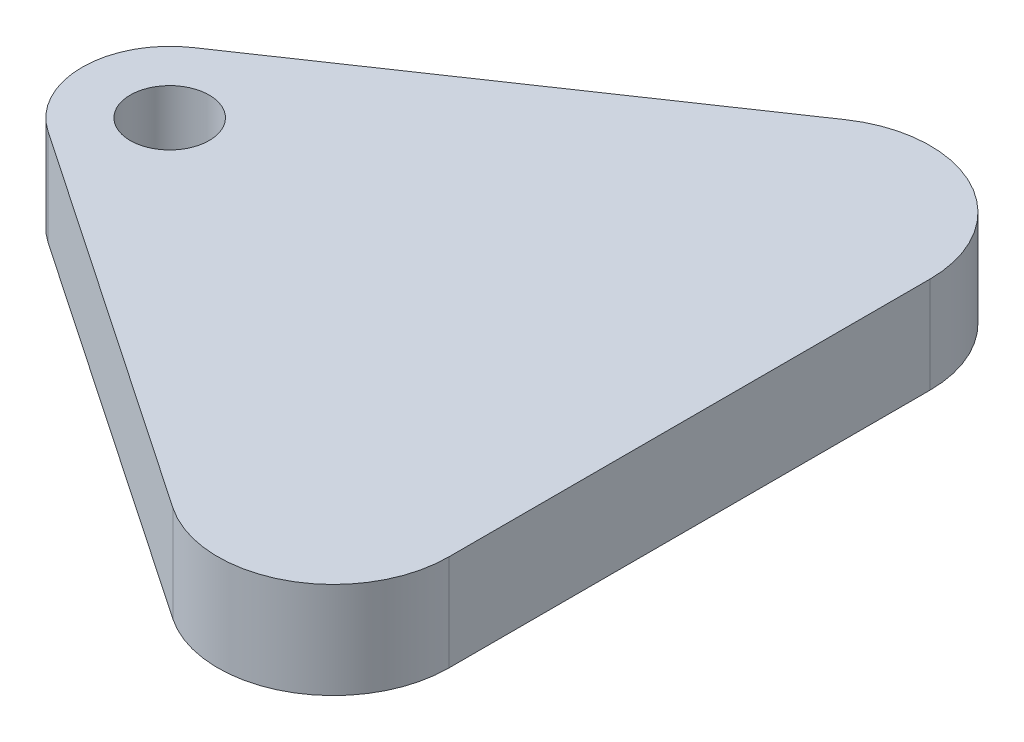
from build123d import *

# Parameters (mm, degrees)
SKETCH_1_R          = 4.1
EXTRUDE_1_DEPTH     = 10
SKETCH_2_W          = 10.2
SKETCH_2_H          = 10.2
CUT_EXTRUDE_1_DEPTH = 5


with BuildPart() as part:
    # ｽｹｯﾁ1 → ﾎﾞｽ - 押し出し1 (new body)
    with BuildSketch(Plane(origin=(0, 0, 0), x_dir=(1, 0, 0), z_dir=(0, 1, 0))):
        with BuildLine():
            Line((-47.110254718, 7.529627927), (-6.738797431, 34.929179684))
            ThreePointArc((-6.738797431, 34.929179684), (5.618470914, 35.603432679), (12, 25))
            Line((12, 25), (12, -25))
            ThreePointArc((12, -25), (5.618470914, -35.603432679), (-6.738797431, -34.929179684))
            Line((-6.738797431, -34.929179684), (-47.110254718, -7.529627927))
            ThreePointArc((-47.110254718, -7.529627927), (-51.1, 0), (-47.110254718, 7.529627927))
        make_face()
        with Locations((-42, 0)):
            Circle(SKETCH_1_R, mode=Mode.SUBTRACT)
    extrude(amount=EXTRUDE_1_DEPTH)

    # ｽｹｯﾁ2 → ｶｯﾄ - 押し出し1 (cut)
    with BuildSketch(Plane.XZ):
        with Locations((0, 25)):
            Rectangle(SKETCH_2_W, SKETCH_2_H)
        with Locations((0, -25)):
            Rectangle(SKETCH_2_W, SKETCH_2_H)
    extrude(amount=-CUT_EXTRUDE_1_DEPTH, mode=Mode.SUBTRACT)


solid = part.part
